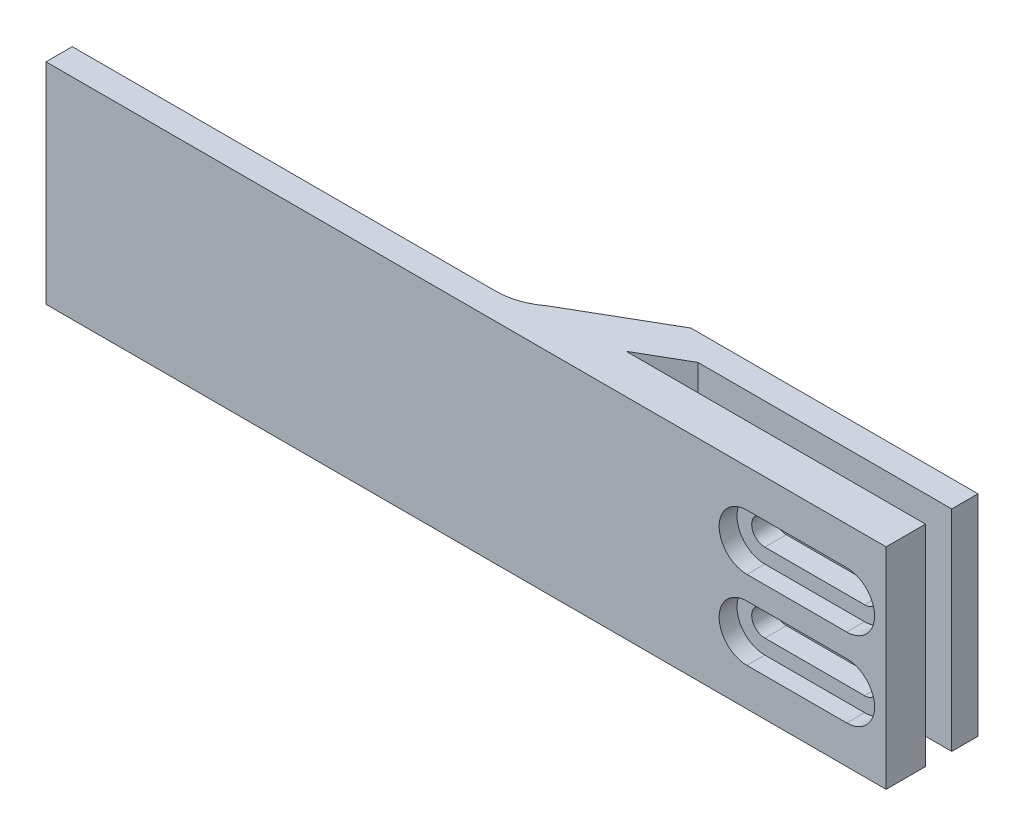
from build123d import *

# Parameters (mm, degrees)
BOSS_EXTRUDE1_DEPTH = 25.4
SKETCH3_W           = 55.88
SKETCH3_H           = 25.4
CUT_EXTRUDE1_DEPTH  = 1.5875
FILLET1_R           = 7.62
CUT_EXTRUDE2_REACH  = 107.315
CUT_EXTRUDE3_DEPTH  = 2.159


with BuildPart() as part:
    # Sketch1 → Boss-Extrude1 (new body)
    with BuildSketch(Plane(origin=(0, 0, 0), x_dir=(1, 0, 0), z_dir=(0, 1, 0))):
        Polygon((-22.587652327, -6.35), (-36.195, -6.35), (-30.695738686, -3.175), (-15.498938433, -3.175), (0, -3.175), (0, 0), (-34.721477372, 0), (-45.72, -6.35), (-101.6, -6.35), (-101.6, -11.1125), (0, -11.1125), (0, -6.35), (-15.498938433, -6.35), align=None)
    extrude(amount=BOSS_EXTRUDE1_DEPTH)

    # Sketch3 → Cut-Extrude1 (cut)
    with BuildSketch(Plane(origin=(0, 0, 6.35), x_dir=(-1, 0, 0), z_dir=(0, 0, -1))):
        with Locations((73.66, 12.7)):
            Rectangle(SKETCH3_W, SKETCH3_H)
    extrude(amount=-CUT_EXTRUDE1_DEPTH, mode=Mode.SUBTRACT)

    # Fillet1
    # the kernel refuses this fillet: 7.62 mm, written as the material it adds along each edge
    with BuildSketch(Plane(origin=(-45.72, 0, 7.9375), x_dir=(-1, 0, 0), z_dir=(0, 1, 0))) as fillet1_piece_1:
        with BuildLine():
            CenterArc((4.65546386, -7.62), FILLET1_R, 90, 37.658462006)
            Line((0, -1.5875), (-0.093109277, -1.46685))
            ThreePointArc((-0.093109277, -1.46685), (-0.1524, -0.79375), (-0.1524, 0))
            Line((-0.1524, 0), (0, 0.1524))
            Line((0, 0.1524), (4.65546386, 0.1524))
            Line((4.65546386, 0.1524), (4.65546386, 0))
        make_face()
    extrude(amount=25.4)

    # Cut-Extrude2: up to this face of the body (flat: up to its plane)
    cut_extrude2_end = Plane(part.part.faces().sort_by_distance((-17.360738686, 12.7, 0))[0])
    # Sketch4 → Cut-Extrude2 (cut, up to the picked face)
    with BuildSketch(Plane.XY.offset(11.1125), mode=Mode.PRIVATE) as cut_extrude2_sk1:
        with BuildLine():
            Line((-4.7625, 19.05), (-16.8275, 19.05))
            ThreePointArc((-16.8275, 19.05), (-18.415, 17.4625), (-16.8275, 15.875))
            Line((-16.8275, 15.875), (-4.7625, 15.875))
            ThreePointArc((-4.7625, 15.875), (-3.175, 17.4625), (-4.7625, 19.05))
        make_face()
    cut_extrude2_tool1 = split(extrude(cut_extrude2_sk1.sketch, amount=-CUT_EXTRUDE2_REACH, mode=Mode.PRIVATE), bisect_by=cut_extrude2_end, keep=Keep.BOTH, mode=Mode.PRIVATE)
    # Sketch4 → Cut-Extrude2 (cut, up to the picked face)
    with BuildSketch(Plane.XY.offset(11.1125), mode=Mode.PRIVATE) as cut_extrude2_sk2:
        with BuildLine():
            Line((-4.7625, 6.35), (-16.8275, 6.35))
            ThreePointArc((-16.8275, 6.35), (-18.415, 7.9375), (-16.8275, 9.525))
            Line((-16.8275, 9.525), (-4.7625, 9.525))
            ThreePointArc((-4.7625, 9.525), (-3.175, 7.9375), (-4.7625, 6.35))
        make_face()
    cut_extrude2_tool2 = split(extrude(cut_extrude2_sk2.sketch, amount=-CUT_EXTRUDE2_REACH, mode=Mode.PRIVATE), bisect_by=cut_extrude2_end, keep=Keep.BOTH, mode=Mode.PRIVATE)
    add(cut_extrude2_tool1.solids().sort_by(Axis((-10.795, 17.4625, 11.1125), (0, 0, -1)))[0], mode=Mode.SUBTRACT)
    add(cut_extrude2_tool2.solids().sort_by(Axis((-10.795, 7.9375, 11.1125), (0, 0, -1)))[0], mode=Mode.SUBTRACT)

    # Sketch5 → Cut-Extrude3 (cut)
    with BuildSketch(Plane.XY.offset(11.1125)):
        with BuildLine():
            Line((-4.7625, 4.572), (-16.8275, 4.572))
            ThreePointArc((-16.8275, 4.572), (-20.193, 7.9375), (-16.8275, 11.303))
            Line((-16.8275, 11.303), (-4.7625, 11.303))
            ThreePointArc((-4.7625, 11.303), (-1.397, 7.9375), (-4.7625, 4.572))
        make_face()
        with BuildLine():
            Line((-4.7625, 14.097), (-16.8275, 14.097))
            ThreePointArc((-16.8275, 14.097), (-20.193, 17.4625), (-16.8275, 20.828))
            Line((-16.8275, 20.828), (-4.7625, 20.828))
            ThreePointArc((-4.7625, 20.828), (-1.397, 17.4625), (-4.7625, 14.097))
        make_face()
    extrude(amount=-CUT_EXTRUDE3_DEPTH, mode=Mode.SUBTRACT)


solid = part.part
